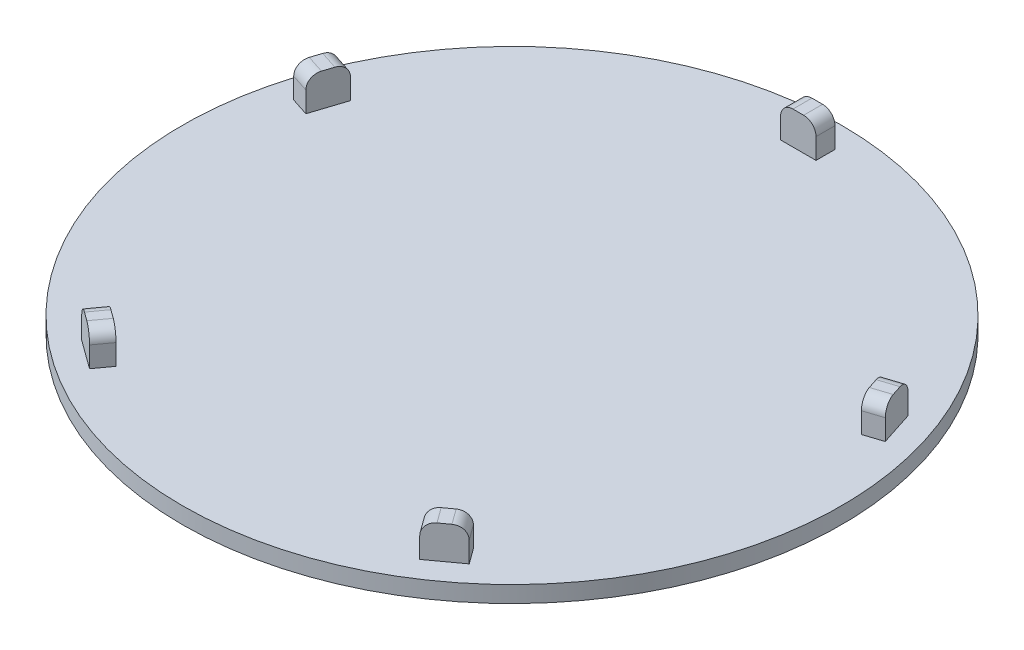
from build123d import *

# Parameters (mm, degrees)
SKETCH1_R           = 40
BOSS_EXTRUDE1_DEPTH = 2
SKETCH2_W           = 4.6
SKETCH2_H           = 2.6
BOSS_EXTRUDE2_DEPTH = 4
SKETCH3_R           = 36
SKETCH3_R_2         = 34
BOSS_EXTRUDE3_DEPTH = 2
FILLET2_R           = 1
CUT_EXTRUDE1_DEPTH  = 2
SKETCH5_W           = 4.6
SKETCH5_H           = 2.6
SKETCH5_W_2         = 4.3
SKETCH5_H_2         = 2.3
CUT_EXTRUDE2_DEPTH  = 4
FILLET3_R           = 1.5


with BuildPart() as part:
    # Sketch1 → Boss-Extrude1 (new body)
    with BuildSketch(Plane(origin=(0, 0, 0), x_dir=(1, 0, 0), z_dir=(0, 1, 0))):
        with Locations(Location((0, 0, 0), (0, 0, 270))):
            Circle(SKETCH1_R)
    extrude(amount=BOSS_EXTRUDE1_DEPTH)

    # Sketch2 → Boss-Extrude2 (add)
    with BuildSketch(Plane(origin=(0, 2, 0), x_dir=(1, 0, 0), z_dir=(0, 1, 0))):
        with Locations((0, 35.9)):
            Rectangle(SKETCH2_W, SKETCH2_H)
        Polygon((34.668563319, 13.682862178), (36.090041493, 9.308002203), (33.617294551, 8.504558018), (32.195816377, 12.879417993), align=None)
        Polygon((23.726350472, -28.74352611), (20.004872298, -31.447338271), (18.476630642, -29.343894086), (22.198108816, -26.640081925), align=None)
        Polygon((-20.004872298, -31.447338271), (-23.726350472, -28.74352611), (-22.198108816, -26.640081925), (-18.476630642, -29.343894086), align=None)
        Polygon((-36.090041493, 9.308002203), (-34.668563319, 13.682862178), (-32.195816377, 12.879417993), (-33.617294551, 8.504558018), align=None)
    extrude(amount=BOSS_EXTRUDE2_DEPTH)

    # Sketch3 → Boss-Extrude3 (add)
    with BuildSketch(Plane.XZ):
        with Locations(Location((0, 0, 0), (0, 0, 90))):
            Circle(SKETCH3_R)
        with Locations(Location((0, 0, 0), (0, 0, 270))):
            Circle(SKETCH3_R_2, mode=Mode.SUBTRACT)
    extrude(amount=BOSS_EXTRUDE3_DEPTH)

    # Fillet2
    fillet2_edges = [part.edges().sort_by_distance(p)[0] for p in [
        (0, -2, -36),
        (0, -2, 34),
    ]]
    fillet(fillet2_edges, radius=FILLET2_R - 0.0001)  # a hair under: the kernel refuses the full size

    # Sketch4 → Cut-Extrude1 (cut)
    with BuildSketch(Plane.XZ):
        Polygon((-1.5, -40), (-1.5, -1.5), (-40, -1.5), (-40, 1.5), (-1.5, 1.5), (-1.5, 40), (1.5, 40), (1.5, 1.5), (40, 1.5), (40, -1.5), (1.5, -1.5), (1.5, -40), align=None)
    extrude(amount=CUT_EXTRUDE1_DEPTH, mode=Mode.SUBTRACT)

    # Sketch5 → Cut-Extrude2 (cut)
    # profile 1 of 5: a face of its own
    with BuildSketch(Plane(origin=(0, 6, 0), x_dir=(1, 0, 0), z_dir=(0, 1, 0))):
        Polygon((34.668563319, 13.682862178), (32.195816377, 12.879417993), (33.617294551, 8.504558018), (36.090041493, 9.308002203), align=None)
        Polygon((34.572257391, 13.493851152), (32.384827403, 12.783112065), (33.713600479, 8.693569044), (35.901030467, 9.404308132), align=None, mode=Mode.SUBTRACT)
    # profile 2 of 5: a face of its own
    with BuildSketch(Plane(origin=(0, 6, 0), x_dir=(1, 0, 0), z_dir=(0, 1, 0))):
        with Locations((0, 35.9)):
            Rectangle(SKETCH5_W, SKETCH5_H)
        with Locations((0, 35.9)):
            Rectangle(SKETCH5_W_2, SKETCH5_H_2, mode=Mode.SUBTRACT)
    # profile 3 of 5: a face of its own
    with BuildSketch(Plane(origin=(0, 6, 0), x_dir=(1, 0, 0), z_dir=(0, 1, 0))):
        Polygon((23.726350472, -28.74352611), (22.198108816, -26.640081925), (18.476630642, -29.343894086), (20.004872298, -31.447338271), align=None)
        Polygon((23.516830135, -28.710341349), (22.164924055, -26.849602262), (18.686150979, -29.377078847), (20.03805706, -31.237817934), align=None, mode=Mode.SUBTRACT)
    # profile 4 of 5: a face of its own
    with BuildSketch(Plane(origin=(0, 6, 0), x_dir=(1, 0, 0), z_dir=(0, 1, 0))):
        Polygon((-20.004872298, -31.447338271), (-18.476630642, -29.343894086), (-22.198108816, -26.640081925), (-23.726350472, -28.74352611), align=None)
        Polygon((-20.03805706, -31.237817934), (-18.686150979, -29.377078847), (-22.164924055, -26.849602262), (-23.516830135, -28.710341349), align=None, mode=Mode.SUBTRACT)
    # profile 5 of 5: a face of its own
    with BuildSketch(Plane(origin=(0, 6, 0), x_dir=(1, 0, 0), z_dir=(0, 1, 0))):
        Polygon((-36.090041493, 9.308002203), (-33.617294551, 8.504558018), (-32.195816377, 12.879417993), (-34.668563319, 13.682862178), align=None)
        Polygon((-35.901030467, 9.404308132), (-33.713600479, 8.693569044), (-32.384827403, 12.783112065), (-34.572257391, 13.493851152), align=None, mode=Mode.SUBTRACT)
    extrude(amount=-CUT_EXTRUDE2_DEPTH, mode=Mode.SUBTRACT)

    # Fillet3
    fillet3_edges = [part.edges().sort_by_distance(p)[0] for p in [
        (-2.15, 6, -35.9),
        (2.15, 6, -35.9),
        (33.478542397, 6, -13.138481608),
        (34.807315473, 6, -9.048938588),
        (22.840877095, 6, 27.779971806),
        (19.362104019, 6, 30.30744839),
        (-19.362104019, 6, 30.30744839),
        (-22.840877095, 6, 27.779971806),
        (-34.807315473, 6, -9.048938588),
        (-33.478542397, 6, -13.138481608),
    ]]
    fillet(fillet3_edges, radius=FILLET3_R)


solid = part.part
